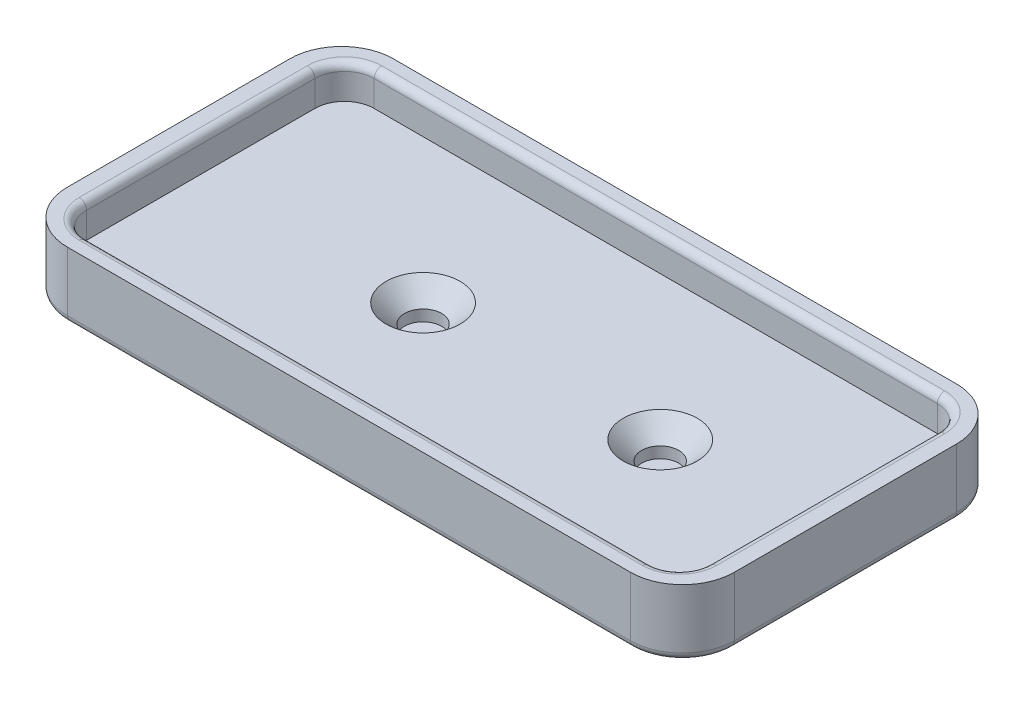
from build123d import *

# Parameters (mm, degrees)
SKETCH_1_W          = 90
SKETCH_1_H          = 44
EXTRUDE_1_DEPTH     = 9
FILLET_1_R          = 7
SKETCH_2_W          = 84
SKETCH_2_H          = 38.8
CUT_EXTRUDE_1_DEPTH = 4.5
SKETCH_3_R          = 2.5
CUT_EXTRUDE_2_DEPTH = 4
CHAMFER_1_SIZE      = 2.5
FILLET_2_R          = 4
FILLET_3_R          = 1
FILLET_4_R          = 1


with BuildPart() as part:
    # Эскиз1 → Бобышка-Вытянуть1 (new body)
    with BuildSketch(Plane(origin=(0, 0, 0), x_dir=(1, 0, 0), z_dir=(0, 1, 0))):
        Rectangle(SKETCH_1_W, SKETCH_1_H)
    extrude(amount=EXTRUDE_1_DEPTH)

    # Скругление1
    fillet_1_edges = [part.edges().sort_by_distance(p)[0] for p in [
        (-45, 4.5, -22),
        (-45, 4.5, 22),
        (45, 4.5, -22),
        (45, 4.5, 22),
    ]]
    fillet(fillet_1_edges, radius=FILLET_1_R)

    # Эскиз2 → Вырез-Вытянуть1 (cut)
    with BuildSketch(Plane(origin=(0, 9, 0), x_dir=(1, 0, 0), z_dir=(0, 1, 0))):
        Rectangle(SKETCH_2_W, SKETCH_2_H)
    extrude(amount=-CUT_EXTRUDE_1_DEPTH, mode=Mode.SUBTRACT)

    # Эскиз3 → Вырез-Вытянуть2 (cut)
    with BuildSketch(Plane(origin=(0, 4.5, 0), x_dir=(1, 0, 0), z_dir=(0, 1, 0))):
        with Locations((20, 0)):
            Circle(SKETCH_3_R)
        with Locations((-12, 0)):
            Circle(SKETCH_3_R)
    extrude(amount=-CUT_EXTRUDE_2_DEPTH, mode=Mode.SUBTRACT)

    # Фаска1
    chamfer_1_edges = [part.edges().sort_by_distance(p)[0] for p in [
        (-14.5, 4.5, 0),
        (17.5, 4.5, 0),
    ]]
    chamfer(chamfer_1_edges, length=CHAMFER_1_SIZE)

    # Скругление2
    fillet_2_edges = [part.edges().sort_by_distance(p)[0] for p in [
        (-42, 6.75, 19.4),
        (42, 6.75, 19.4),
        (42, 6.75, -19.4),
        (-42, 6.75, -19.4),
    ]]
    fillet(fillet_2_edges, radius=FILLET_2_R)

    # Скругление3
    fillet_3_edges = [part.edges().sort_by_distance(p)[0] for p in [
        (40.828427125, 9, -18.228427125),
        (42, 9, 0),
        (40.828427125, 9, 18.228427125),
        (0, 9, 19.4),
        (-40.828427125, 9, 18.228427125),
        (-42, 9, 0),
        (-40.828427125, 9, -18.228427125),
        (0, 9, -19.4),
    ]]
    fillet(fillet_3_edges, radius=FILLET_3_R)

    # Скругление4
    fillet_4_edges = [part.edges().sort_by_distance(p)[0] for p in [
        (-42.949747468, 0, 19.949747468),
        (0, 0, 22),
        (42.949747468, 0, 19.949747468),
        (45, 0, 0),
        (42.949747468, 0, -19.949747468),
        (0, 0, -22),
        (-42.949747468, 0, -19.949747468),
        (-45, 0, 0),
    ]]
    fillet(fillet_4_edges, radius=FILLET_4_R)


solid = part.part
